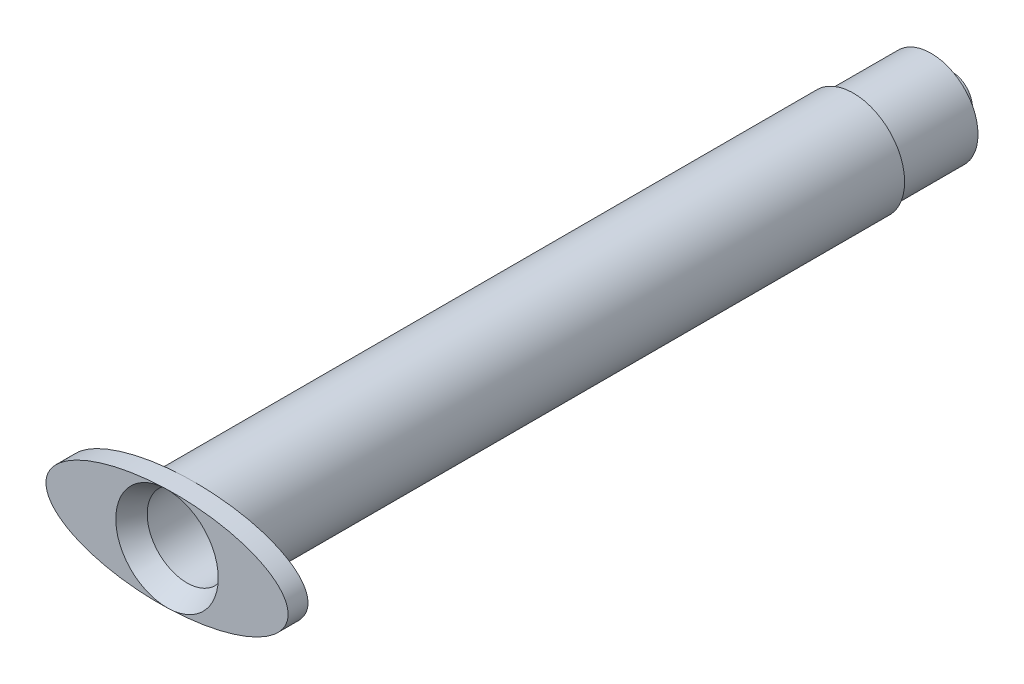
from build123d import *

# Parameters (mm, degrees)
SKETCH1_R           = 5.17
SKETCH1_R_2         = 4.1
BOSS_EXTRUDE1_DEPTH = 67.25
SKETCH2_RX          = 12.22
SKETCH2_RY          = 5.17
BOSS_EXTRUDE2_DEPTH = 2.01
SKETCH3_R           = 5.17
CUT_EXTRUDE1_DEPTH  = 2.01
CUT_EXTRUDE1_DRAFT  = -30
SKETCH4_R           = 2.06
SKETCH4_R_2         = 0.795
BOSS_EXTRUDE3_DEPTH = 9.95
SKETCH5_R           = 4.0952596
BOSS_EXTRUDE4_DEPTH = 1.15
SKETCH7_R           = 0.795
CUT_EXTRUDE2_DEPTH  = 81.313643922
SKETCH9_R           = 4.725
SKETCH9_R_2         = 4.11
BOSS_EXTRUDE6_DEPTH = 7.85


with BuildPart() as part:
    # Sketch1 → Boss-Extrude1 (new body)
    with BuildSketch(Plane.XY):
        Circle(SKETCH1_R)
        Circle(SKETCH1_R_2, mode=Mode.SUBTRACT)
    extrude(amount=BOSS_EXTRUDE1_DEPTH)

    # Sketch2 → Boss-Extrude2 (add)
    with BuildSketch(Plane.XY.offset(67.25)):
        with Locations(Location((0, 0), (0, 0, -177.979667621))):
            Ellipse(SKETCH2_RX, SKETCH2_RY)
    extrude(amount=BOSS_EXTRUDE2_DEPTH)


with BuildPart() as cut_extrude1_tool:
    # Sketch3 → Cut-Extrude1 (with draft: the straight prism first)
    with BuildSketch(Plane.XY.offset(69.26)):
        Circle(SKETCH3_R)
    extrude(amount=-CUT_EXTRUDE1_DEPTH)
    # Cut-Extrude1: the draft: its side faces are tilted about the plane it starts from
    cut_extrude1_sides = [cut_extrude1_tool.faces().sort_by_distance(p)[0] for p in [
        (-5.17, 0, 68.255),
    ]]
    draft(cut_extrude1_sides, Plane.XY.offset(69.26), CUT_EXTRUDE1_DRAFT)


with BuildPart() as part_1:
    add(part.part)

    # Cut-Extrude1: cut by cut_extrude1_tool
    add(cut_extrude1_tool.part, mode=Mode.SUBTRACT)

    # Sketch9 → Boss-Extrude6 (add)
    with BuildSketch(Plane(origin=(0, 0, 0), x_dir=(-1, 0, 0), z_dir=(0, 0, -1))):
        Circle(SKETCH9_R)
        Circle(SKETCH9_R_2, mode=Mode.SUBTRACT)
    extrude(amount=BOSS_EXTRUDE6_DEPTH)


with BuildPart() as body_2:
    # Sketch4 → Boss-Extrude3 (new body)
    with BuildSketch(Plane(origin=(0, 0, 0), x_dir=(-1, 0, 0), z_dir=(0, 0, -1))):
        Circle(SKETCH4_R)
        Circle(SKETCH4_R_2, mode=Mode.SUBTRACT)
    extrude(amount=BOSS_EXTRUDE3_DEPTH)

    # Sketch5 → Boss-Extrude4 (add)
    with BuildSketch(Plane(origin=(0, 0, 0), x_dir=(-1, 0, 0), z_dir=(0, 0, -1))):
        Circle(SKETCH5_R)
    extrude(amount=BOSS_EXTRUDE4_DEPTH)

    # Sketch7 → Cut-Extrude2 (cut, through all)
    with BuildSketch(Plane(origin=(0, 0, -9.95), x_dir=(-1, 0, 0), z_dir=(0, 0, -1))):
        Circle(SKETCH7_R)
    extrude(amount=-CUT_EXTRUDE2_DEPTH, mode=Mode.SUBTRACT)


solid = Compound([part_1.part, body_2.part])
